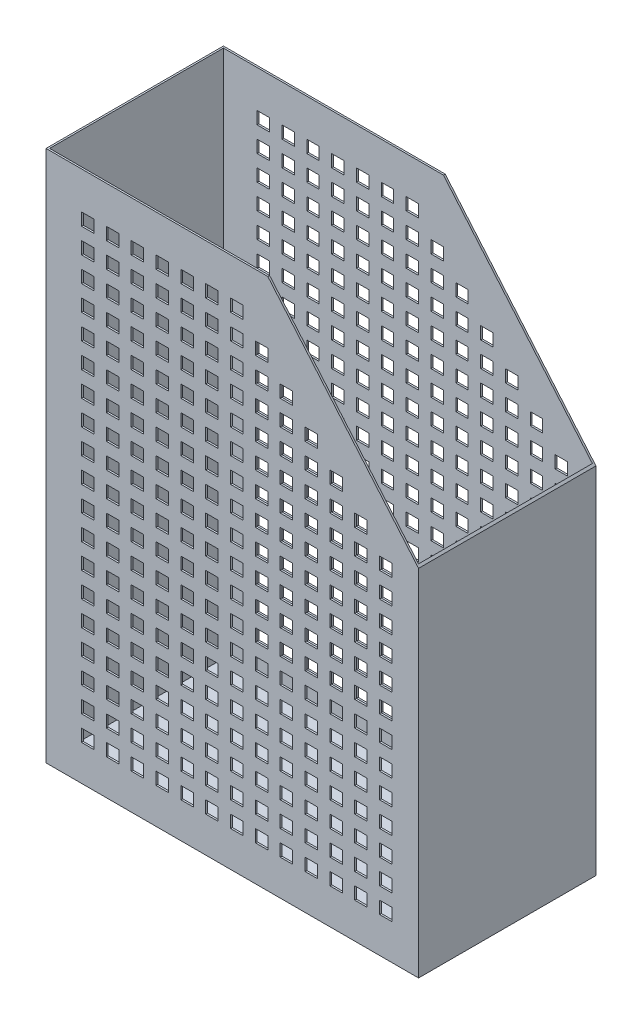
from build123d import *

# Parameters (mm, degrees)
BOSS_EXTRUDE1_DEPTH       = 50
SHELL1_T                  = -1
SHELL1_THICKNESS_2_FACE_W = 208
SHELL1_THICKNESS_2_FACE_H = 98
SHELL1_THICKNESS_2_DEPTH  = 1
SKETCH2_OUTSIDE_W         = 287.922
SKETCH2_OUTSIDE_H         = 377.922
SKETCH2_OUTSIDE_W_2       = 7
SKETCH2_OUTSIDE_H_2       = 7
CUT_EXTRUDE2_DEPTH        = 380.605057922


with BuildPart() as part:
    # Sketch1 → Boss-Extrude1 (new, symmetric)
    with BuildSketch(Plane.XY):
        Polygon((0, 0), (0, 300), (125, 300), (210, 200), (210, 0), align=None)
    extrude(amount=BOSS_EXTRUDE1_DEPTH, both=True)

    # Shell1
    shell1_openings = [part.faces().sort_by_distance(p)[0] for p in [
        (62.5, 300, 0),
        (167.5, 250, 0),
    ]]
    offset(amount=SHELL1_T, openings=shell1_openings, kind=Kind.INTERSECTION)

    # Shell1 thickness 2 face (on inner face of the shell) → Shell1 thickness 2 (add)
    with BuildSketch(Plane(origin=(105, 1, 0), x_dir=(-1, 0, 0), z_dir=(0, -1, 0))):
        Rectangle(SHELL1_THICKNESS_2_FACE_W, SHELL1_THICKNESS_2_FACE_H)
    extrude(amount=-SHELL1_THICKNESS_2_DEPTH)

    # Sketch2 outside → Cut-Extrude2 (cut, through all)
    # profile 1 of 227: a face of its own
    with BuildSketch(Plane.XY.offset(50)):
        with Locations((105, 150)):
            Rectangle(SKETCH2_OUTSIDE_W, SKETCH2_OUTSIDE_H)
        Polygon((0, 0), (210, 0), (210, 200), (125, 300), (0, 300), align=None, mode=Mode.SUBTRACT)
        with Locations((191.5, 233.5)):
            Rectangle(SKETCH2_OUTSIDE_W_2, SKETCH2_OUTSIDE_H_2, mode=Mode.SUBTRACT)
        with Locations((191.5, 247.5)):
            Rectangle(SKETCH2_OUTSIDE_W_2, SKETCH2_OUTSIDE_H_2, mode=Mode.SUBTRACT)
        with Locations((177.5, 261.5)):
            Rectangle(SKETCH2_OUTSIDE_W_2, SKETCH2_OUTSIDE_H_2, mode=Mode.SUBTRACT)
        with Locations((191.5, 261.5)):
            Rectangle(SKETCH2_OUTSIDE_W_2, SKETCH2_OUTSIDE_H_2, mode=Mode.SUBTRACT)
        with Locations((163.5, 275.5)):
            Rectangle(SKETCH2_OUTSIDE_W_2, SKETCH2_OUTSIDE_H_2, mode=Mode.SUBTRACT)
        with Locations((177.5, 275.5)):
            Rectangle(SKETCH2_OUTSIDE_W_2, SKETCH2_OUTSIDE_H_2, mode=Mode.SUBTRACT)
        with Locations((191.5, 275.5)):
            Rectangle(SKETCH2_OUTSIDE_W_2, SKETCH2_OUTSIDE_H_2, mode=Mode.SUBTRACT)
    # profile 2 of 227: a face of its own
    with BuildSketch(Plane.XY.offset(50)):
        with Locations((23.5, 23.5)):
            Rectangle(SKETCH2_OUTSIDE_W_2, SKETCH2_OUTSIDE_H_2)
    # profile 3 of 227: a face of its own
    with BuildSketch(Plane.XY.offset(50)):
        with Locations((37.5, 23.5)):
            Rectangle(SKETCH2_OUTSIDE_W_2, SKETCH2_OUTSIDE_H_2)
    # profile 4 of 227: a face of its own
    with BuildSketch(Plane.XY.offset(50)):
        with Locations((51.5, 23.5)):
            Rectangle(SKETCH2_OUTSIDE_W_2, SKETCH2_OUTSIDE_H_2)
    # profile 5 of 227: a face of its own
    with BuildSketch(Plane.XY.offset(50)):
        with Locations((65.5, 23.5)):
            Rectangle(SKETCH2_OUTSIDE_W_2, SKETCH2_OUTSIDE_H_2)
    # profile 6 of 227: a face of its own
    with BuildSketch(Plane.XY.offset(50)):
        with Locations((79.5, 23.5)):
            Rectangle(SKETCH2_OUTSIDE_W_2, SKETCH2_OUTSIDE_H_2)
    # profile 7 of 227: a face of its own
    with BuildSketch(Plane.XY.offset(50)):
        with Locations((93.5, 23.5)):
            Rectangle(SKETCH2_OUTSIDE_W_2, SKETCH2_OUTSIDE_H_2)
    # profile 8 of 227: a face of its own
    with BuildSketch(Plane.XY.offset(50)):
        with Locations((107.5, 23.5)):
            Rectangle(SKETCH2_OUTSIDE_W_2, SKETCH2_OUTSIDE_H_2)
    # profile 9 of 227: a face of its own
    with BuildSketch(Plane.XY.offset(50)):
        with Locations((121.5, 23.5)):
            Rectangle(SKETCH2_OUTSIDE_W_2, SKETCH2_OUTSIDE_H_2)
    # profile 10 of 227: a face of its own
    with BuildSketch(Plane.XY.offset(50)):
        with Locations((135.5, 23.5)):
            Rectangle(SKETCH2_OUTSIDE_W_2, SKETCH2_OUTSIDE_H_2)
    # profile 11 of 227: a face of its own
    with BuildSketch(Plane.XY.offset(50)):
        with Locations((149.5, 23.5)):
            Rectangle(SKETCH2_OUTSIDE_W_2, SKETCH2_OUTSIDE_H_2)
    # profile 12 of 227: a face of its own
    with BuildSketch(Plane.XY.offset(50)):
        with Locations((163.5, 23.5)):
            Rectangle(SKETCH2_OUTSIDE_W_2, SKETCH2_OUTSIDE_H_2)
    # profile 13 of 227: a face of its own
    with BuildSketch(Plane.XY.offset(50)):
        with Locations((177.5, 23.5)):
            Rectangle(SKETCH2_OUTSIDE_W_2, SKETCH2_OUTSIDE_H_2)
    # profile 14 of 227: a face of its own
    with BuildSketch(Plane.XY.offset(50)):
        with Locations((191.5, 23.5)):
            Rectangle(SKETCH2_OUTSIDE_W_2, SKETCH2_OUTSIDE_H_2)
    # profile 15 of 227: a face of its own
    with BuildSketch(Plane.XY.offset(50)):
        with Locations((37.5, 37.5)):
            Rectangle(SKETCH2_OUTSIDE_W_2, SKETCH2_OUTSIDE_H_2)
    # profile 16 of 227: a face of its own
    with BuildSketch(Plane.XY.offset(50)):
        with Locations((51.5, 37.5)):
            Rectangle(SKETCH2_OUTSIDE_W_2, SKETCH2_OUTSIDE_H_2)
    # profile 17 of 227: a face of its own
    with BuildSketch(Plane.XY.offset(50)):
        with Locations((65.5, 37.5)):
            Rectangle(SKETCH2_OUTSIDE_W_2, SKETCH2_OUTSIDE_H_2)
    # profile 18 of 227: a face of its own
    with BuildSketch(Plane.XY.offset(50)):
        with Locations((79.5, 37.5)):
            Rectangle(SKETCH2_OUTSIDE_W_2, SKETCH2_OUTSIDE_H_2)
    # profile 19 of 227: a face of its own
    with BuildSketch(Plane.XY.offset(50)):
        with Locations((93.5, 37.5)):
            Rectangle(SKETCH2_OUTSIDE_W_2, SKETCH2_OUTSIDE_H_2)
    # profile 20 of 227: a face of its own
    with BuildSketch(Plane.XY.offset(50)):
        with Locations((107.5, 37.5)):
            Rectangle(SKETCH2_OUTSIDE_W_2, SKETCH2_OUTSIDE_H_2)
    # profile 21 of 227: a face of its own
    with BuildSketch(Plane.XY.offset(50)):
        with Locations((121.5, 37.5)):
            Rectangle(SKETCH2_OUTSIDE_W_2, SKETCH2_OUTSIDE_H_2)
    # profile 22 of 227: a face of its own
    with BuildSketch(Plane.XY.offset(50)):
        with Locations((135.5, 37.5)):
            Rectangle(SKETCH2_OUTSIDE_W_2, SKETCH2_OUTSIDE_H_2)
    # profile 23 of 227: a face of its own
    with BuildSketch(Plane.XY.offset(50)):
        with Locations((149.5, 37.5)):
            Rectangle(SKETCH2_OUTSIDE_W_2, SKETCH2_OUTSIDE_H_2)
    # profile 24 of 227: a face of its own
    with BuildSketch(Plane.XY.offset(50)):
        with Locations((163.5, 37.5)):
            Rectangle(SKETCH2_OUTSIDE_W_2, SKETCH2_OUTSIDE_H_2)
    # profile 25 of 227: a face of its own
    with BuildSketch(Plane.XY.offset(50)):
        with Locations((177.5, 37.5)):
            Rectangle(SKETCH2_OUTSIDE_W_2, SKETCH2_OUTSIDE_H_2)
    # profile 26 of 227: a face of its own
    with BuildSketch(Plane.XY.offset(50)):
        with Locations((191.5, 37.5)):
            Rectangle(SKETCH2_OUTSIDE_W_2, SKETCH2_OUTSIDE_H_2)
    # profile 27 of 227: a face of its own
    with BuildSketch(Plane.XY.offset(50)):
        with Locations((37.5, 51.5)):
            Rectangle(SKETCH2_OUTSIDE_W_2, SKETCH2_OUTSIDE_H_2)
    # profile 28 of 227: a face of its own
    with BuildSketch(Plane.XY.offset(50)):
        with Locations((51.5, 51.5)):
            Rectangle(SKETCH2_OUTSIDE_W_2, SKETCH2_OUTSIDE_H_2)
    # profile 29 of 227: a face of its own
    with BuildSketch(Plane.XY.offset(50)):
        with Locations((65.5, 51.5)):
            Rectangle(SKETCH2_OUTSIDE_W_2, SKETCH2_OUTSIDE_H_2)
    # profile 30 of 227: a face of its own
    with BuildSketch(Plane.XY.offset(50)):
        with Locations((79.5, 51.5)):
            Rectangle(SKETCH2_OUTSIDE_W_2, SKETCH2_OUTSIDE_H_2)
    # profile 31 of 227: a face of its own
    with BuildSketch(Plane.XY.offset(50)):
        with Locations((93.5, 51.5)):
            Rectangle(SKETCH2_OUTSIDE_W_2, SKETCH2_OUTSIDE_H_2)
    # profile 32 of 227: a face of its own
    with BuildSketch(Plane.XY.offset(50)):
        with Locations((107.5, 51.5)):
            Rectangle(SKETCH2_OUTSIDE_W_2, SKETCH2_OUTSIDE_H_2)
    # profile 33 of 227: a face of its own
    with BuildSketch(Plane.XY.offset(50)):
        with Locations((121.5, 51.5)):
            Rectangle(SKETCH2_OUTSIDE_W_2, SKETCH2_OUTSIDE_H_2)
    # profile 34 of 227: a face of its own
    with BuildSketch(Plane.XY.offset(50)):
        with Locations((135.5, 51.5)):
            Rectangle(SKETCH2_OUTSIDE_W_2, SKETCH2_OUTSIDE_H_2)
    # profile 35 of 227: a face of its own
    with BuildSketch(Plane.XY.offset(50)):
        with Locations((149.5, 51.5)):
            Rectangle(SKETCH2_OUTSIDE_W_2, SKETCH2_OUTSIDE_H_2)
    # profile 36 of 227: a face of its own
    with BuildSketch(Plane.XY.offset(50)):
        with Locations((163.5, 51.5)):
            Rectangle(SKETCH2_OUTSIDE_W_2, SKETCH2_OUTSIDE_H_2)
    # profile 37 of 227: a face of its own
    with BuildSketch(Plane.XY.offset(50)):
        with Locations((177.5, 51.5)):
            Rectangle(SKETCH2_OUTSIDE_W_2, SKETCH2_OUTSIDE_H_2)
    # profile 38 of 227: a face of its own
    with BuildSketch(Plane.XY.offset(50)):
        with Locations((191.5, 51.5)):
            Rectangle(SKETCH2_OUTSIDE_W_2, SKETCH2_OUTSIDE_H_2)
    # profile 39 of 227: a face of its own
    with BuildSketch(Plane.XY.offset(50)):
        with Locations((37.5, 65.5)):
            Rectangle(SKETCH2_OUTSIDE_W_2, SKETCH2_OUTSIDE_H_2)
    # profile 40 of 227: a face of its own
    with BuildSketch(Plane.XY.offset(50)):
        with Locations((51.5, 65.5)):
            Rectangle(SKETCH2_OUTSIDE_W_2, SKETCH2_OUTSIDE_H_2)
    # profile 41 of 227: a face of its own
    with BuildSketch(Plane.XY.offset(50)):
        with Locations((65.5, 65.5)):
            Rectangle(SKETCH2_OUTSIDE_W_2, SKETCH2_OUTSIDE_H_2)
    # profile 42 of 227: a face of its own
    with BuildSketch(Plane.XY.offset(50)):
        with Locations((79.5, 65.5)):
            Rectangle(SKETCH2_OUTSIDE_W_2, SKETCH2_OUTSIDE_H_2)
    # profile 43 of 227: a face of its own
    with BuildSketch(Plane.XY.offset(50)):
        with Locations((93.5, 65.5)):
            Rectangle(SKETCH2_OUTSIDE_W_2, SKETCH2_OUTSIDE_H_2)
    # profile 44 of 227: a face of its own
    with BuildSketch(Plane.XY.offset(50)):
        with Locations((107.5, 65.5)):
            Rectangle(SKETCH2_OUTSIDE_W_2, SKETCH2_OUTSIDE_H_2)
    # profile 45 of 227: a face of its own
    with BuildSketch(Plane.XY.offset(50)):
        with Locations((121.5, 65.5)):
            Rectangle(SKETCH2_OUTSIDE_W_2, SKETCH2_OUTSIDE_H_2)
    # profile 46 of 227: a face of its own
    with BuildSketch(Plane.XY.offset(50)):
        with Locations((135.5, 65.5)):
            Rectangle(SKETCH2_OUTSIDE_W_2, SKETCH2_OUTSIDE_H_2)
    # profile 47 of 227: a face of its own
    with BuildSketch(Plane.XY.offset(50)):
        with Locations((149.5, 65.5)):
            Rectangle(SKETCH2_OUTSIDE_W_2, SKETCH2_OUTSIDE_H_2)
    # profile 48 of 227: a face of its own
    with BuildSketch(Plane.XY.offset(50)):
        with Locations((163.5, 65.5)):
            Rectangle(SKETCH2_OUTSIDE_W_2, SKETCH2_OUTSIDE_H_2)
    # profile 49 of 227: a face of its own
    with BuildSketch(Plane.XY.offset(50)):
        with Locations((177.5, 65.5)):
            Rectangle(SKETCH2_OUTSIDE_W_2, SKETCH2_OUTSIDE_H_2)
    # profile 50 of 227: a face of its own
    with BuildSketch(Plane.XY.offset(50)):
        with Locations((191.5, 65.5)):
            Rectangle(SKETCH2_OUTSIDE_W_2, SKETCH2_OUTSIDE_H_2)
    # profile 51 of 227: a face of its own
    with BuildSketch(Plane.XY.offset(50)):
        with Locations((37.5, 79.5)):
            Rectangle(SKETCH2_OUTSIDE_W_2, SKETCH2_OUTSIDE_H_2)
    # profile 52 of 227: a face of its own
    with BuildSketch(Plane.XY.offset(50)):
        with Locations((51.5, 79.5)):
            Rectangle(SKETCH2_OUTSIDE_W_2, SKETCH2_OUTSIDE_H_2)
    # profile 53 of 227: a face of its own
    with BuildSketch(Plane.XY.offset(50)):
        with Locations((65.5, 79.5)):
            Rectangle(SKETCH2_OUTSIDE_W_2, SKETCH2_OUTSIDE_H_2)
    # profile 54 of 227: a face of its own
    with BuildSketch(Plane.XY.offset(50)):
        with Locations((79.5, 79.5)):
            Rectangle(SKETCH2_OUTSIDE_W_2, SKETCH2_OUTSIDE_H_2)
    # profile 55 of 227: a face of its own
    with BuildSketch(Plane.XY.offset(50)):
        with Locations((93.5, 79.5)):
            Rectangle(SKETCH2_OUTSIDE_W_2, SKETCH2_OUTSIDE_H_2)
    # profile 56 of 227: a face of its own
    with BuildSketch(Plane.XY.offset(50)):
        with Locations((107.5, 79.5)):
            Rectangle(SKETCH2_OUTSIDE_W_2, SKETCH2_OUTSIDE_H_2)
    # profile 57 of 227: a face of its own
    with BuildSketch(Plane.XY.offset(50)):
        with Locations((121.5, 79.5)):
            Rectangle(SKETCH2_OUTSIDE_W_2, SKETCH2_OUTSIDE_H_2)
    # profile 58 of 227: a face of its own
    with BuildSketch(Plane.XY.offset(50)):
        with Locations((135.5, 79.5)):
            Rectangle(SKETCH2_OUTSIDE_W_2, SKETCH2_OUTSIDE_H_2)
    # profile 59 of 227: a face of its own
    with BuildSketch(Plane.XY.offset(50)):
        with Locations((149.5, 79.5)):
            Rectangle(SKETCH2_OUTSIDE_W_2, SKETCH2_OUTSIDE_H_2)
    # profile 60 of 227: a face of its own
    with BuildSketch(Plane.XY.offset(50)):
        with Locations((163.5, 79.5)):
            Rectangle(SKETCH2_OUTSIDE_W_2, SKETCH2_OUTSIDE_H_2)
    # profile 61 of 227: a face of its own
    with BuildSketch(Plane.XY.offset(50)):
        with Locations((177.5, 79.5)):
            Rectangle(SKETCH2_OUTSIDE_W_2, SKETCH2_OUTSIDE_H_2)
    # profile 62 of 227: a face of its own
    with BuildSketch(Plane.XY.offset(50)):
        with Locations((191.5, 79.5)):
            Rectangle(SKETCH2_OUTSIDE_W_2, SKETCH2_OUTSIDE_H_2)
    # profile 63 of 227: a face of its own
    with BuildSketch(Plane.XY.offset(50)):
        with Locations((37.5, 93.5)):
            Rectangle(SKETCH2_OUTSIDE_W_2, SKETCH2_OUTSIDE_H_2)
    # profile 64 of 227: a face of its own
    with BuildSketch(Plane.XY.offset(50)):
        with Locations((51.5, 93.5)):
            Rectangle(SKETCH2_OUTSIDE_W_2, SKETCH2_OUTSIDE_H_2)
    # profile 65 of 227: a face of its own
    with BuildSketch(Plane.XY.offset(50)):
        with Locations((65.5, 93.5)):
            Rectangle(SKETCH2_OUTSIDE_W_2, SKETCH2_OUTSIDE_H_2)
    # profile 66 of 227: a face of its own
    with BuildSketch(Plane.XY.offset(50)):
        with Locations((79.5, 93.5)):
            Rectangle(SKETCH2_OUTSIDE_W_2, SKETCH2_OUTSIDE_H_2)
    # profile 67 of 227: a face of its own
    with BuildSketch(Plane.XY.offset(50)):
        with Locations((93.5, 93.5)):
            Rectangle(SKETCH2_OUTSIDE_W_2, SKETCH2_OUTSIDE_H_2)
    # profile 68 of 227: a face of its own
    with BuildSketch(Plane.XY.offset(50)):
        with Locations((107.5, 93.5)):
            Rectangle(SKETCH2_OUTSIDE_W_2, SKETCH2_OUTSIDE_H_2)
    # profile 69 of 227: a face of its own
    with BuildSketch(Plane.XY.offset(50)):
        with Locations((121.5, 93.5)):
            Rectangle(SKETCH2_OUTSIDE_W_2, SKETCH2_OUTSIDE_H_2)
    # profile 70 of 227: a face of its own
    with BuildSketch(Plane.XY.offset(50)):
        with Locations((135.5, 93.5)):
            Rectangle(SKETCH2_OUTSIDE_W_2, SKETCH2_OUTSIDE_H_2)
    # profile 71 of 227: a face of its own
    with BuildSketch(Plane.XY.offset(50)):
        with Locations((149.5, 93.5)):
            Rectangle(SKETCH2_OUTSIDE_W_2, SKETCH2_OUTSIDE_H_2)
    # profile 72 of 227: a face of its own
    with BuildSketch(Plane.XY.offset(50)):
        with Locations((163.5, 93.5)):
            Rectangle(SKETCH2_OUTSIDE_W_2, SKETCH2_OUTSIDE_H_2)
    # profile 73 of 227: a face of its own
    with BuildSketch(Plane.XY.offset(50)):
        with Locations((177.5, 93.5)):
            Rectangle(SKETCH2_OUTSIDE_W_2, SKETCH2_OUTSIDE_H_2)
    # profile 74 of 227: a face of its own
    with BuildSketch(Plane.XY.offset(50)):
        with Locations((191.5, 93.5)):
            Rectangle(SKETCH2_OUTSIDE_W_2, SKETCH2_OUTSIDE_H_2)
    # profile 75 of 227: a face of its own
    with BuildSketch(Plane.XY.offset(50)):
        with Locations((37.5, 107.5)):
            Rectangle(SKETCH2_OUTSIDE_W_2, SKETCH2_OUTSIDE_H_2)
    # profile 76 of 227: a face of its own
    with BuildSketch(Plane.XY.offset(50)):
        with Locations((51.5, 107.5)):
            Rectangle(SKETCH2_OUTSIDE_W_2, SKETCH2_OUTSIDE_H_2)
    # profile 77 of 227: a face of its own
    with BuildSketch(Plane.XY.offset(50)):
        with Locations((65.5, 107.5)):
            Rectangle(SKETCH2_OUTSIDE_W_2, SKETCH2_OUTSIDE_H_2)
    # profile 78 of 227: a face of its own
    with BuildSketch(Plane.XY.offset(50)):
        with Locations((79.5, 107.5)):
            Rectangle(SKETCH2_OUTSIDE_W_2, SKETCH2_OUTSIDE_H_2)
    # profile 79 of 227: a face of its own
    with BuildSketch(Plane.XY.offset(50)):
        with Locations((93.5, 107.5)):
            Rectangle(SKETCH2_OUTSIDE_W_2, SKETCH2_OUTSIDE_H_2)
    # profile 80 of 227: a face of its own
    with BuildSketch(Plane.XY.offset(50)):
        with Locations((107.5, 107.5)):
            Rectangle(SKETCH2_OUTSIDE_W_2, SKETCH2_OUTSIDE_H_2)
    # profile 81 of 227: a face of its own
    with BuildSketch(Plane.XY.offset(50)):
        with Locations((121.5, 107.5)):
            Rectangle(SKETCH2_OUTSIDE_W_2, SKETCH2_OUTSIDE_H_2)
    # profile 82 of 227: a face of its own
    with BuildSketch(Plane.XY.offset(50)):
        with Locations((135.5, 107.5)):
            Rectangle(SKETCH2_OUTSIDE_W_2, SKETCH2_OUTSIDE_H_2)
    # profile 83 of 227: a face of its own
    with BuildSketch(Plane.XY.offset(50)):
        with Locations((149.5, 107.5)):
            Rectangle(SKETCH2_OUTSIDE_W_2, SKETCH2_OUTSIDE_H_2)
    # profile 84 of 227: a face of its own
    with BuildSketch(Plane.XY.offset(50)):
        with Locations((163.5, 107.5)):
            Rectangle(SKETCH2_OUTSIDE_W_2, SKETCH2_OUTSIDE_H_2)
    # profile 85 of 227: a face of its own
    with BuildSketch(Plane.XY.offset(50)):
        with Locations((177.5, 107.5)):
            Rectangle(SKETCH2_OUTSIDE_W_2, SKETCH2_OUTSIDE_H_2)
    # profile 86 of 227: a face of its own
    with BuildSketch(Plane.XY.offset(50)):
        with Locations((191.5, 107.5)):
            Rectangle(SKETCH2_OUTSIDE_W_2, SKETCH2_OUTSIDE_H_2)
    # profile 87 of 227: a face of its own
    with BuildSketch(Plane.XY.offset(50)):
        with Locations((37.5, 121.5)):
            Rectangle(SKETCH2_OUTSIDE_W_2, SKETCH2_OUTSIDE_H_2)
    # profile 88 of 227: a face of its own
    with BuildSketch(Plane.XY.offset(50)):
        with Locations((51.5, 121.5)):
            Rectangle(SKETCH2_OUTSIDE_W_2, SKETCH2_OUTSIDE_H_2)
    # profile 89 of 227: a face of its own
    with BuildSketch(Plane.XY.offset(50)):
        with Locations((65.5, 121.5)):
            Rectangle(SKETCH2_OUTSIDE_W_2, SKETCH2_OUTSIDE_H_2)
    # profile 90 of 227: a face of its own
    with BuildSketch(Plane.XY.offset(50)):
        with Locations((79.5, 121.5)):
            Rectangle(SKETCH2_OUTSIDE_W_2, SKETCH2_OUTSIDE_H_2)
    # profile 91 of 227: a face of its own
    with BuildSketch(Plane.XY.offset(50)):
        with Locations((93.5, 121.5)):
            Rectangle(SKETCH2_OUTSIDE_W_2, SKETCH2_OUTSIDE_H_2)
    # profile 92 of 227: a face of its own
    with BuildSketch(Plane.XY.offset(50)):
        with Locations((107.5, 121.5)):
            Rectangle(SKETCH2_OUTSIDE_W_2, SKETCH2_OUTSIDE_H_2)
    # profile 93 of 227: a face of its own
    with BuildSketch(Plane.XY.offset(50)):
        with Locations((121.5, 121.5)):
            Rectangle(SKETCH2_OUTSIDE_W_2, SKETCH2_OUTSIDE_H_2)
    # profile 94 of 227: a face of its own
    with BuildSketch(Plane.XY.offset(50)):
        with Locations((135.5, 121.5)):
            Rectangle(SKETCH2_OUTSIDE_W_2, SKETCH2_OUTSIDE_H_2)
    # profile 95 of 227: a face of its own
    with BuildSketch(Plane.XY.offset(50)):
        with Locations((149.5, 121.5)):
            Rectangle(SKETCH2_OUTSIDE_W_2, SKETCH2_OUTSIDE_H_2)
    # profile 96 of 227: a face of its own
    with BuildSketch(Plane.XY.offset(50)):
        with Locations((163.5, 121.5)):
            Rectangle(SKETCH2_OUTSIDE_W_2, SKETCH2_OUTSIDE_H_2)
    # profile 97 of 227: a face of its own
    with BuildSketch(Plane.XY.offset(50)):
        with Locations((177.5, 121.5)):
            Rectangle(SKETCH2_OUTSIDE_W_2, SKETCH2_OUTSIDE_H_2)
    # profile 98 of 227: a face of its own
    with BuildSketch(Plane.XY.offset(50)):
        with Locations((191.5, 121.5)):
            Rectangle(SKETCH2_OUTSIDE_W_2, SKETCH2_OUTSIDE_H_2)
    # profile 99 of 227: a face of its own
    with BuildSketch(Plane.XY.offset(50)):
        with Locations((37.5, 135.5)):
            Rectangle(SKETCH2_OUTSIDE_W_2, SKETCH2_OUTSIDE_H_2)
    # profile 100 of 227: a face of its own
    with BuildSketch(Plane.XY.offset(50)):
        with Locations((51.5, 135.5)):
            Rectangle(SKETCH2_OUTSIDE_W_2, SKETCH2_OUTSIDE_H_2)
    # profile 101 of 227: a face of its own
    with BuildSketch(Plane.XY.offset(50)):
        with Locations((65.5, 135.5)):
            Rectangle(SKETCH2_OUTSIDE_W_2, SKETCH2_OUTSIDE_H_2)
    # profile 102 of 227: a face of its own
    with BuildSketch(Plane.XY.offset(50)):
        with Locations((79.5, 135.5)):
            Rectangle(SKETCH2_OUTSIDE_W_2, SKETCH2_OUTSIDE_H_2)
    # profile 103 of 227: a face of its own
    with BuildSketch(Plane.XY.offset(50)):
        with Locations((93.5, 135.5)):
            Rectangle(SKETCH2_OUTSIDE_W_2, SKETCH2_OUTSIDE_H_2)
    # profile 104 of 227: a face of its own
    with BuildSketch(Plane.XY.offset(50)):
        with Locations((107.5, 135.5)):
            Rectangle(SKETCH2_OUTSIDE_W_2, SKETCH2_OUTSIDE_H_2)
    # profile 105 of 227: a face of its own
    with BuildSketch(Plane.XY.offset(50)):
        with Locations((121.5, 135.5)):
            Rectangle(SKETCH2_OUTSIDE_W_2, SKETCH2_OUTSIDE_H_2)
    # profile 106 of 227: a face of its own
    with BuildSketch(Plane.XY.offset(50)):
        with Locations((135.5, 135.5)):
            Rectangle(SKETCH2_OUTSIDE_W_2, SKETCH2_OUTSIDE_H_2)
    # profile 107 of 227: a face of its own
    with BuildSketch(Plane.XY.offset(50)):
        with Locations((149.5, 135.5)):
            Rectangle(SKETCH2_OUTSIDE_W_2, SKETCH2_OUTSIDE_H_2)
    # profile 108 of 227: a face of its own
    with BuildSketch(Plane.XY.offset(50)):
        with Locations((163.5, 135.5)):
            Rectangle(SKETCH2_OUTSIDE_W_2, SKETCH2_OUTSIDE_H_2)
    # profile 109 of 227: a face of its own
    with BuildSketch(Plane.XY.offset(50)):
        with Locations((177.5, 135.5)):
            Rectangle(SKETCH2_OUTSIDE_W_2, SKETCH2_OUTSIDE_H_2)
    # profile 110 of 227: a face of its own
    with BuildSketch(Plane.XY.offset(50)):
        with Locations((191.5, 135.5)):
            Rectangle(SKETCH2_OUTSIDE_W_2, SKETCH2_OUTSIDE_H_2)
    # profile 111 of 227: a face of its own
    with BuildSketch(Plane.XY.offset(50)):
        with Locations((37.5, 149.5)):
            Rectangle(SKETCH2_OUTSIDE_W_2, SKETCH2_OUTSIDE_H_2)
    # profile 112 of 227: a face of its own
    with BuildSketch(Plane.XY.offset(50)):
        with Locations((51.5, 149.5)):
            Rectangle(SKETCH2_OUTSIDE_W_2, SKETCH2_OUTSIDE_H_2)
    # profile 113 of 227: a face of its own
    with BuildSketch(Plane.XY.offset(50)):
        with Locations((65.5, 149.5)):
            Rectangle(SKETCH2_OUTSIDE_W_2, SKETCH2_OUTSIDE_H_2)
    # profile 114 of 227: a face of its own
    with BuildSketch(Plane.XY.offset(50)):
        with Locations((79.5, 149.5)):
            Rectangle(SKETCH2_OUTSIDE_W_2, SKETCH2_OUTSIDE_H_2)
    # profile 115 of 227: a face of its own
    with BuildSketch(Plane.XY.offset(50)):
        with Locations((93.5, 149.5)):
            Rectangle(SKETCH2_OUTSIDE_W_2, SKETCH2_OUTSIDE_H_2)
    # profile 116 of 227: a face of its own
    with BuildSketch(Plane.XY.offset(50)):
        with Locations((107.5, 149.5)):
            Rectangle(SKETCH2_OUTSIDE_W_2, SKETCH2_OUTSIDE_H_2)
    # profile 117 of 227: a face of its own
    with BuildSketch(Plane.XY.offset(50)):
        with Locations((121.5, 149.5)):
            Rectangle(SKETCH2_OUTSIDE_W_2, SKETCH2_OUTSIDE_H_2)
    # profile 118 of 227: a face of its own
    with BuildSketch(Plane.XY.offset(50)):
        with Locations((135.5, 149.5)):
            Rectangle(SKETCH2_OUTSIDE_W_2, SKETCH2_OUTSIDE_H_2)
    # profile 119 of 227: a face of its own
    with BuildSketch(Plane.XY.offset(50)):
        with Locations((149.5, 149.5)):
            Rectangle(SKETCH2_OUTSIDE_W_2, SKETCH2_OUTSIDE_H_2)
    # profile 120 of 227: a face of its own
    with BuildSketch(Plane.XY.offset(50)):
        with Locations((163.5, 149.5)):
            Rectangle(SKETCH2_OUTSIDE_W_2, SKETCH2_OUTSIDE_H_2)
    # profile 121 of 227: a face of its own
    with BuildSketch(Plane.XY.offset(50)):
        with Locations((177.5, 149.5)):
            Rectangle(SKETCH2_OUTSIDE_W_2, SKETCH2_OUTSIDE_H_2)
    # profile 122 of 227: a face of its own
    with BuildSketch(Plane.XY.offset(50)):
        with Locations((191.5, 149.5)):
            Rectangle(SKETCH2_OUTSIDE_W_2, SKETCH2_OUTSIDE_H_2)
    # profile 123 of 227: a face of its own
    with BuildSketch(Plane.XY.offset(50)):
        with Locations((37.5, 163.5)):
            Rectangle(SKETCH2_OUTSIDE_W_2, SKETCH2_OUTSIDE_H_2)
    # profile 124 of 227: a face of its own
    with BuildSketch(Plane.XY.offset(50)):
        with Locations((51.5, 163.5)):
            Rectangle(SKETCH2_OUTSIDE_W_2, SKETCH2_OUTSIDE_H_2)
    # profile 125 of 227: a face of its own
    with BuildSketch(Plane.XY.offset(50)):
        with Locations((65.5, 163.5)):
            Rectangle(SKETCH2_OUTSIDE_W_2, SKETCH2_OUTSIDE_H_2)
    # profile 126 of 227: a face of its own
    with BuildSketch(Plane.XY.offset(50)):
        with Locations((79.5, 163.5)):
            Rectangle(SKETCH2_OUTSIDE_W_2, SKETCH2_OUTSIDE_H_2)
    # profile 127 of 227: a face of its own
    with BuildSketch(Plane.XY.offset(50)):
        with Locations((93.5, 163.5)):
            Rectangle(SKETCH2_OUTSIDE_W_2, SKETCH2_OUTSIDE_H_2)
    # profile 128 of 227: a face of its own
    with BuildSketch(Plane.XY.offset(50)):
        with Locations((107.5, 163.5)):
            Rectangle(SKETCH2_OUTSIDE_W_2, SKETCH2_OUTSIDE_H_2)
    # profile 129 of 227: a face of its own
    with BuildSketch(Plane.XY.offset(50)):
        with Locations((121.5, 163.5)):
            Rectangle(SKETCH2_OUTSIDE_W_2, SKETCH2_OUTSIDE_H_2)
    # profile 130 of 227: a face of its own
    with BuildSketch(Plane.XY.offset(50)):
        with Locations((135.5, 163.5)):
            Rectangle(SKETCH2_OUTSIDE_W_2, SKETCH2_OUTSIDE_H_2)
    # profile 131 of 227: a face of its own
    with BuildSketch(Plane.XY.offset(50)):
        with Locations((149.5, 163.5)):
            Rectangle(SKETCH2_OUTSIDE_W_2, SKETCH2_OUTSIDE_H_2)
    # profile 132 of 227: a face of its own
    with BuildSketch(Plane.XY.offset(50)):
        with Locations((163.5, 163.5)):
            Rectangle(SKETCH2_OUTSIDE_W_2, SKETCH2_OUTSIDE_H_2)
    # profile 133 of 227: a face of its own
    with BuildSketch(Plane.XY.offset(50)):
        with Locations((177.5, 163.5)):
            Rectangle(SKETCH2_OUTSIDE_W_2, SKETCH2_OUTSIDE_H_2)
    # profile 134 of 227: a face of its own
    with BuildSketch(Plane.XY.offset(50)):
        with Locations((191.5, 163.5)):
            Rectangle(SKETCH2_OUTSIDE_W_2, SKETCH2_OUTSIDE_H_2)
    # profile 135 of 227: a face of its own
    with BuildSketch(Plane.XY.offset(50)):
        with Locations((37.5, 177.5)):
            Rectangle(SKETCH2_OUTSIDE_W_2, SKETCH2_OUTSIDE_H_2)
    # profile 136 of 227: a face of its own
    with BuildSketch(Plane.XY.offset(50)):
        with Locations((51.5, 177.5)):
            Rectangle(SKETCH2_OUTSIDE_W_2, SKETCH2_OUTSIDE_H_2)
    # profile 137 of 227: a face of its own
    with BuildSketch(Plane.XY.offset(50)):
        with Locations((65.5, 177.5)):
            Rectangle(SKETCH2_OUTSIDE_W_2, SKETCH2_OUTSIDE_H_2)
    # profile 138 of 227: a face of its own
    with BuildSketch(Plane.XY.offset(50)):
        with Locations((79.5, 177.5)):
            Rectangle(SKETCH2_OUTSIDE_W_2, SKETCH2_OUTSIDE_H_2)
    # profile 139 of 227: a face of its own
    with BuildSketch(Plane.XY.offset(50)):
        with Locations((93.5, 177.5)):
            Rectangle(SKETCH2_OUTSIDE_W_2, SKETCH2_OUTSIDE_H_2)
    # profile 140 of 227: a face of its own
    with BuildSketch(Plane.XY.offset(50)):
        with Locations((107.5, 177.5)):
            Rectangle(SKETCH2_OUTSIDE_W_2, SKETCH2_OUTSIDE_H_2)
    # profile 141 of 227: a face of its own
    with BuildSketch(Plane.XY.offset(50)):
        with Locations((121.5, 177.5)):
            Rectangle(SKETCH2_OUTSIDE_W_2, SKETCH2_OUTSIDE_H_2)
    # profile 142 of 227: a face of its own
    with BuildSketch(Plane.XY.offset(50)):
        with Locations((135.5, 177.5)):
            Rectangle(SKETCH2_OUTSIDE_W_2, SKETCH2_OUTSIDE_H_2)
    # profile 143 of 227: a face of its own
    with BuildSketch(Plane.XY.offset(50)):
        with Locations((149.5, 177.5)):
            Rectangle(SKETCH2_OUTSIDE_W_2, SKETCH2_OUTSIDE_H_2)
    # profile 144 of 227: a face of its own
    with BuildSketch(Plane.XY.offset(50)):
        with Locations((163.5, 177.5)):
            Rectangle(SKETCH2_OUTSIDE_W_2, SKETCH2_OUTSIDE_H_2)
    # profile 145 of 227: a face of its own
    with BuildSketch(Plane.XY.offset(50)):
        with Locations((177.5, 177.5)):
            Rectangle(SKETCH2_OUTSIDE_W_2, SKETCH2_OUTSIDE_H_2)
    # profile 146 of 227: a face of its own
    with BuildSketch(Plane.XY.offset(50)):
        with Locations((191.5, 177.5)):
            Rectangle(SKETCH2_OUTSIDE_W_2, SKETCH2_OUTSIDE_H_2)
    # profile 147 of 227: a face of its own
    with BuildSketch(Plane.XY.offset(50)):
        with Locations((37.5, 191.5)):
            Rectangle(SKETCH2_OUTSIDE_W_2, SKETCH2_OUTSIDE_H_2)
    # profile 148 of 227: a face of its own
    with BuildSketch(Plane.XY.offset(50)):
        with Locations((51.5, 191.5)):
            Rectangle(SKETCH2_OUTSIDE_W_2, SKETCH2_OUTSIDE_H_2)
    # profile 149 of 227: a face of its own
    with BuildSketch(Plane.XY.offset(50)):
        with Locations((65.5, 191.5)):
            Rectangle(SKETCH2_OUTSIDE_W_2, SKETCH2_OUTSIDE_H_2)
    # profile 150 of 227: a face of its own
    with BuildSketch(Plane.XY.offset(50)):
        with Locations((79.5, 191.5)):
            Rectangle(SKETCH2_OUTSIDE_W_2, SKETCH2_OUTSIDE_H_2)
    # profile 151 of 227: a face of its own
    with BuildSketch(Plane.XY.offset(50)):
        with Locations((93.5, 191.5)):
            Rectangle(SKETCH2_OUTSIDE_W_2, SKETCH2_OUTSIDE_H_2)
    # profile 152 of 227: a face of its own
    with BuildSketch(Plane.XY.offset(50)):
        with Locations((107.5, 191.5)):
            Rectangle(SKETCH2_OUTSIDE_W_2, SKETCH2_OUTSIDE_H_2)
    # profile 153 of 227: a face of its own
    with BuildSketch(Plane.XY.offset(50)):
        with Locations((121.5, 191.5)):
            Rectangle(SKETCH2_OUTSIDE_W_2, SKETCH2_OUTSIDE_H_2)
    # profile 154 of 227: a face of its own
    with BuildSketch(Plane.XY.offset(50)):
        with Locations((135.5, 191.5)):
            Rectangle(SKETCH2_OUTSIDE_W_2, SKETCH2_OUTSIDE_H_2)
    # profile 155 of 227: a face of its own
    with BuildSketch(Plane.XY.offset(50)):
        with Locations((149.5, 191.5)):
            Rectangle(SKETCH2_OUTSIDE_W_2, SKETCH2_OUTSIDE_H_2)
    # profile 156 of 227: a face of its own
    with BuildSketch(Plane.XY.offset(50)):
        with Locations((163.5, 191.5)):
            Rectangle(SKETCH2_OUTSIDE_W_2, SKETCH2_OUTSIDE_H_2)
    # profile 157 of 227: a face of its own
    with BuildSketch(Plane.XY.offset(50)):
        with Locations((177.5, 191.5)):
            Rectangle(SKETCH2_OUTSIDE_W_2, SKETCH2_OUTSIDE_H_2)
    # profile 158 of 227: a face of its own
    with BuildSketch(Plane.XY.offset(50)):
        with Locations((191.5, 191.5)):
            Rectangle(SKETCH2_OUTSIDE_W_2, SKETCH2_OUTSIDE_H_2)
    # profile 159 of 227: a face of its own
    with BuildSketch(Plane.XY.offset(50)):
        with Locations((37.5, 205.5)):
            Rectangle(SKETCH2_OUTSIDE_W_2, SKETCH2_OUTSIDE_H_2)
    # profile 160 of 227: a face of its own
    with BuildSketch(Plane.XY.offset(50)):
        with Locations((51.5, 205.5)):
            Rectangle(SKETCH2_OUTSIDE_W_2, SKETCH2_OUTSIDE_H_2)
    # profile 161 of 227: a face of its own
    with BuildSketch(Plane.XY.offset(50)):
        with Locations((65.5, 205.5)):
            Rectangle(SKETCH2_OUTSIDE_W_2, SKETCH2_OUTSIDE_H_2)
    # profile 162 of 227: a face of its own
    with BuildSketch(Plane.XY.offset(50)):
        with Locations((79.5, 205.5)):
            Rectangle(SKETCH2_OUTSIDE_W_2, SKETCH2_OUTSIDE_H_2)
    # profile 163 of 227: a face of its own
    with BuildSketch(Plane.XY.offset(50)):
        with Locations((93.5, 205.5)):
            Rectangle(SKETCH2_OUTSIDE_W_2, SKETCH2_OUTSIDE_H_2)
    # profile 164 of 227: a face of its own
    with BuildSketch(Plane.XY.offset(50)):
        with Locations((107.5, 205.5)):
            Rectangle(SKETCH2_OUTSIDE_W_2, SKETCH2_OUTSIDE_H_2)
    # profile 165 of 227: a face of its own
    with BuildSketch(Plane.XY.offset(50)):
        with Locations((121.5, 205.5)):
            Rectangle(SKETCH2_OUTSIDE_W_2, SKETCH2_OUTSIDE_H_2)
    # profile 166 of 227: a face of its own
    with BuildSketch(Plane.XY.offset(50)):
        with Locations((135.5, 205.5)):
            Rectangle(SKETCH2_OUTSIDE_W_2, SKETCH2_OUTSIDE_H_2)
    # profile 167 of 227: a face of its own
    with BuildSketch(Plane.XY.offset(50)):
        with Locations((149.5, 205.5)):
            Rectangle(SKETCH2_OUTSIDE_W_2, SKETCH2_OUTSIDE_H_2)
    # profile 168 of 227: a face of its own
    with BuildSketch(Plane.XY.offset(50)):
        with Locations((163.5, 205.5)):
            Rectangle(SKETCH2_OUTSIDE_W_2, SKETCH2_OUTSIDE_H_2)
    # profile 169 of 227: a face of its own
    with BuildSketch(Plane.XY.offset(50)):
        with Locations((177.5, 205.5)):
            Rectangle(SKETCH2_OUTSIDE_W_2, SKETCH2_OUTSIDE_H_2)
    # profile 170 of 227: a face of its own
    with BuildSketch(Plane.XY.offset(50)):
        with Locations((37.5, 219.5)):
            Rectangle(SKETCH2_OUTSIDE_W_2, SKETCH2_OUTSIDE_H_2)
    # profile 171 of 227: a face of its own
    with BuildSketch(Plane.XY.offset(50)):
        with Locations((51.5, 219.5)):
            Rectangle(SKETCH2_OUTSIDE_W_2, SKETCH2_OUTSIDE_H_2)
    # profile 172 of 227: a face of its own
    with BuildSketch(Plane.XY.offset(50)):
        with Locations((65.5, 219.5)):
            Rectangle(SKETCH2_OUTSIDE_W_2, SKETCH2_OUTSIDE_H_2)
    # profile 173 of 227: a face of its own
    with BuildSketch(Plane.XY.offset(50)):
        with Locations((79.5, 219.5)):
            Rectangle(SKETCH2_OUTSIDE_W_2, SKETCH2_OUTSIDE_H_2)
    # profile 174 of 227: a face of its own
    with BuildSketch(Plane.XY.offset(50)):
        with Locations((93.5, 219.5)):
            Rectangle(SKETCH2_OUTSIDE_W_2, SKETCH2_OUTSIDE_H_2)
    # profile 175 of 227: a face of its own
    with BuildSketch(Plane.XY.offset(50)):
        with Locations((107.5, 219.5)):
            Rectangle(SKETCH2_OUTSIDE_W_2, SKETCH2_OUTSIDE_H_2)
    # profile 176 of 227: a face of its own
    with BuildSketch(Plane.XY.offset(50)):
        with Locations((121.5, 219.5)):
            Rectangle(SKETCH2_OUTSIDE_W_2, SKETCH2_OUTSIDE_H_2)
    # profile 177 of 227: a face of its own
    with BuildSketch(Plane.XY.offset(50)):
        with Locations((135.5, 219.5)):
            Rectangle(SKETCH2_OUTSIDE_W_2, SKETCH2_OUTSIDE_H_2)
    # profile 178 of 227: a face of its own
    with BuildSketch(Plane.XY.offset(50)):
        with Locations((149.5, 219.5)):
            Rectangle(SKETCH2_OUTSIDE_W_2, SKETCH2_OUTSIDE_H_2)
    # profile 179 of 227: a face of its own
    with BuildSketch(Plane.XY.offset(50)):
        with Locations((163.5, 219.5)):
            Rectangle(SKETCH2_OUTSIDE_W_2, SKETCH2_OUTSIDE_H_2)
    # profile 180 of 227: a face of its own
    with BuildSketch(Plane.XY.offset(50)):
        with Locations((37.5, 233.5)):
            Rectangle(SKETCH2_OUTSIDE_W_2, SKETCH2_OUTSIDE_H_2)
    # profile 181 of 227: a face of its own
    with BuildSketch(Plane.XY.offset(50)):
        with Locations((51.5, 233.5)):
            Rectangle(SKETCH2_OUTSIDE_W_2, SKETCH2_OUTSIDE_H_2)
    # profile 182 of 227: a face of its own
    with BuildSketch(Plane.XY.offset(50)):
        with Locations((65.5, 233.5)):
            Rectangle(SKETCH2_OUTSIDE_W_2, SKETCH2_OUTSIDE_H_2)
    # profile 183 of 227: a face of its own
    with BuildSketch(Plane.XY.offset(50)):
        with Locations((79.5, 233.5)):
            Rectangle(SKETCH2_OUTSIDE_W_2, SKETCH2_OUTSIDE_H_2)
    # profile 184 of 227: a face of its own
    with BuildSketch(Plane.XY.offset(50)):
        with Locations((93.5, 233.5)):
            Rectangle(SKETCH2_OUTSIDE_W_2, SKETCH2_OUTSIDE_H_2)
    # profile 185 of 227: a face of its own
    with BuildSketch(Plane.XY.offset(50)):
        with Locations((107.5, 233.5)):
            Rectangle(SKETCH2_OUTSIDE_W_2, SKETCH2_OUTSIDE_H_2)
    # profile 186 of 227: a face of its own
    with BuildSketch(Plane.XY.offset(50)):
        with Locations((121.5, 233.5)):
            Rectangle(SKETCH2_OUTSIDE_W_2, SKETCH2_OUTSIDE_H_2)
    # profile 187 of 227: a face of its own
    with BuildSketch(Plane.XY.offset(50)):
        with Locations((135.5, 233.5)):
            Rectangle(SKETCH2_OUTSIDE_W_2, SKETCH2_OUTSIDE_H_2)
    # profile 188 of 227: a face of its own
    with BuildSketch(Plane.XY.offset(50)):
        with Locations((149.5, 233.5)):
            Rectangle(SKETCH2_OUTSIDE_W_2, SKETCH2_OUTSIDE_H_2)
    # profile 189 of 227: a face of its own
    with BuildSketch(Plane.XY.offset(50)):
        with Locations((37.5, 247.5)):
            Rectangle(SKETCH2_OUTSIDE_W_2, SKETCH2_OUTSIDE_H_2)
    # profile 190 of 227: a face of its own
    with BuildSketch(Plane.XY.offset(50)):
        with Locations((51.5, 247.5)):
            Rectangle(SKETCH2_OUTSIDE_W_2, SKETCH2_OUTSIDE_H_2)
    # profile 191 of 227: a face of its own
    with BuildSketch(Plane.XY.offset(50)):
        with Locations((65.5, 247.5)):
            Rectangle(SKETCH2_OUTSIDE_W_2, SKETCH2_OUTSIDE_H_2)
    # profile 192 of 227: a face of its own
    with BuildSketch(Plane.XY.offset(50)):
        with Locations((79.5, 247.5)):
            Rectangle(SKETCH2_OUTSIDE_W_2, SKETCH2_OUTSIDE_H_2)
    # profile 193 of 227: a face of its own
    with BuildSketch(Plane.XY.offset(50)):
        with Locations((93.5, 247.5)):
            Rectangle(SKETCH2_OUTSIDE_W_2, SKETCH2_OUTSIDE_H_2)
    # profile 194 of 227: a face of its own
    with BuildSketch(Plane.XY.offset(50)):
        with Locations((107.5, 247.5)):
            Rectangle(SKETCH2_OUTSIDE_W_2, SKETCH2_OUTSIDE_H_2)
    # profile 195 of 227: a face of its own
    with BuildSketch(Plane.XY.offset(50)):
        with Locations((121.5, 247.5)):
            Rectangle(SKETCH2_OUTSIDE_W_2, SKETCH2_OUTSIDE_H_2)
    # profile 196 of 227: a face of its own
    with BuildSketch(Plane.XY.offset(50)):
        with Locations((135.5, 247.5)):
            Rectangle(SKETCH2_OUTSIDE_W_2, SKETCH2_OUTSIDE_H_2)
    # profile 197 of 227: a face of its own
    with BuildSketch(Plane.XY.offset(50)):
        with Locations((37.5, 261.5)):
            Rectangle(SKETCH2_OUTSIDE_W_2, SKETCH2_OUTSIDE_H_2)
    # profile 198 of 227: a face of its own
    with BuildSketch(Plane.XY.offset(50)):
        with Locations((51.5, 261.5)):
            Rectangle(SKETCH2_OUTSIDE_W_2, SKETCH2_OUTSIDE_H_2)
    # profile 199 of 227: a face of its own
    with BuildSketch(Plane.XY.offset(50)):
        with Locations((65.5, 261.5)):
            Rectangle(SKETCH2_OUTSIDE_W_2, SKETCH2_OUTSIDE_H_2)
    # profile 200 of 227: a face of its own
    with BuildSketch(Plane.XY.offset(50)):
        with Locations((79.5, 261.5)):
            Rectangle(SKETCH2_OUTSIDE_W_2, SKETCH2_OUTSIDE_H_2)
    # profile 201 of 227: a face of its own
    with BuildSketch(Plane.XY.offset(50)):
        with Locations((93.5, 261.5)):
            Rectangle(SKETCH2_OUTSIDE_W_2, SKETCH2_OUTSIDE_H_2)
    # profile 202 of 227: a face of its own
    with BuildSketch(Plane.XY.offset(50)):
        with Locations((107.5, 261.5)):
            Rectangle(SKETCH2_OUTSIDE_W_2, SKETCH2_OUTSIDE_H_2)
    # profile 203 of 227: a face of its own
    with BuildSketch(Plane.XY.offset(50)):
        with Locations((121.5, 261.5)):
            Rectangle(SKETCH2_OUTSIDE_W_2, SKETCH2_OUTSIDE_H_2)
    # profile 204 of 227: a face of its own
    with BuildSketch(Plane.XY.offset(50)):
        with Locations((37.5, 275.5)):
            Rectangle(SKETCH2_OUTSIDE_W_2, SKETCH2_OUTSIDE_H_2)
    # profile 205 of 227: a face of its own
    with BuildSketch(Plane.XY.offset(50)):
        with Locations((51.5, 275.5)):
            Rectangle(SKETCH2_OUTSIDE_W_2, SKETCH2_OUTSIDE_H_2)
    # profile 206 of 227: a face of its own
    with BuildSketch(Plane.XY.offset(50)):
        with Locations((65.5, 275.5)):
            Rectangle(SKETCH2_OUTSIDE_W_2, SKETCH2_OUTSIDE_H_2)
    # profile 207 of 227: a face of its own
    with BuildSketch(Plane.XY.offset(50)):
        with Locations((79.5, 275.5)):
            Rectangle(SKETCH2_OUTSIDE_W_2, SKETCH2_OUTSIDE_H_2)
    # profile 208 of 227: a face of its own
    with BuildSketch(Plane.XY.offset(50)):
        with Locations((93.5, 275.5)):
            Rectangle(SKETCH2_OUTSIDE_W_2, SKETCH2_OUTSIDE_H_2)
    # profile 209 of 227: a face of its own
    with BuildSketch(Plane.XY.offset(50)):
        with Locations((107.5, 275.5)):
            Rectangle(SKETCH2_OUTSIDE_W_2, SKETCH2_OUTSIDE_H_2)
    # profile 210 of 227: a face of its own
    with BuildSketch(Plane.XY.offset(50)):
        with Locations((23.5, 37.5)):
            Rectangle(SKETCH2_OUTSIDE_W_2, SKETCH2_OUTSIDE_H_2)
    # profile 211 of 227: a face of its own
    with BuildSketch(Plane.XY.offset(50)):
        with Locations((23.5, 51.5)):
            Rectangle(SKETCH2_OUTSIDE_W_2, SKETCH2_OUTSIDE_H_2)
    # profile 212 of 227: a face of its own
    with BuildSketch(Plane.XY.offset(50)):
        with Locations((23.5, 65.5)):
            Rectangle(SKETCH2_OUTSIDE_W_2, SKETCH2_OUTSIDE_H_2)
    # profile 213 of 227: a face of its own
    with BuildSketch(Plane.XY.offset(50)):
        with Locations((23.5, 79.5)):
            Rectangle(SKETCH2_OUTSIDE_W_2, SKETCH2_OUTSIDE_H_2)
    # profile 214 of 227: a face of its own
    with BuildSketch(Plane.XY.offset(50)):
        with Locations((23.5, 93.5)):
            Rectangle(SKETCH2_OUTSIDE_W_2, SKETCH2_OUTSIDE_H_2)
    # profile 215 of 227: a face of its own
    with BuildSketch(Plane.XY.offset(50)):
        with Locations((23.5, 107.5)):
            Rectangle(SKETCH2_OUTSIDE_W_2, SKETCH2_OUTSIDE_H_2)
    # profile 216 of 227: a face of its own
    with BuildSketch(Plane.XY.offset(50)):
        with Locations((23.5, 121.5)):
            Rectangle(SKETCH2_OUTSIDE_W_2, SKETCH2_OUTSIDE_H_2)
    # profile 217 of 227: a face of its own
    with BuildSketch(Plane.XY.offset(50)):
        with Locations((23.5, 135.5)):
            Rectangle(SKETCH2_OUTSIDE_W_2, SKETCH2_OUTSIDE_H_2)
    # profile 218 of 227: a face of its own
    with BuildSketch(Plane.XY.offset(50)):
        with Locations((23.5, 149.5)):
            Rectangle(SKETCH2_OUTSIDE_W_2, SKETCH2_OUTSIDE_H_2)
    # profile 219 of 227: a face of its own
    with BuildSketch(Plane.XY.offset(50)):
        with Locations((23.5, 163.5)):
            Rectangle(SKETCH2_OUTSIDE_W_2, SKETCH2_OUTSIDE_H_2)
    # profile 220 of 227: a face of its own
    with BuildSketch(Plane.XY.offset(50)):
        with Locations((23.5, 177.5)):
            Rectangle(SKETCH2_OUTSIDE_W_2, SKETCH2_OUTSIDE_H_2)
    # profile 221 of 227: a face of its own
    with BuildSketch(Plane.XY.offset(50)):
        with Locations((23.5, 191.5)):
            Rectangle(SKETCH2_OUTSIDE_W_2, SKETCH2_OUTSIDE_H_2)
    # profile 222 of 227: a face of its own
    with BuildSketch(Plane.XY.offset(50)):
        with Locations((23.5, 205.5)):
            Rectangle(SKETCH2_OUTSIDE_W_2, SKETCH2_OUTSIDE_H_2)
    # profile 223 of 227: a face of its own
    with BuildSketch(Plane.XY.offset(50)):
        with Locations((23.5, 219.5)):
            Rectangle(SKETCH2_OUTSIDE_W_2, SKETCH2_OUTSIDE_H_2)
    # profile 224 of 227: a face of its own
    with BuildSketch(Plane.XY.offset(50)):
        with Locations((23.5, 233.5)):
            Rectangle(SKETCH2_OUTSIDE_W_2, SKETCH2_OUTSIDE_H_2)
    # profile 225 of 227: a face of its own
    with BuildSketch(Plane.XY.offset(50)):
        with Locations((23.5, 247.5)):
            Rectangle(SKETCH2_OUTSIDE_W_2, SKETCH2_OUTSIDE_H_2)
    # profile 226 of 227: a face of its own
    with BuildSketch(Plane.XY.offset(50)):
        with Locations((23.5, 261.5)):
            Rectangle(SKETCH2_OUTSIDE_W_2, SKETCH2_OUTSIDE_H_2)
    # profile 227 of 227: a face of its own
    with BuildSketch(Plane.XY.offset(50)):
        with Locations((23.5, 275.5)):
            Rectangle(SKETCH2_OUTSIDE_W_2, SKETCH2_OUTSIDE_H_2)
    extrude(amount=-CUT_EXTRUDE2_DEPTH, mode=Mode.SUBTRACT)


solid = part.part
